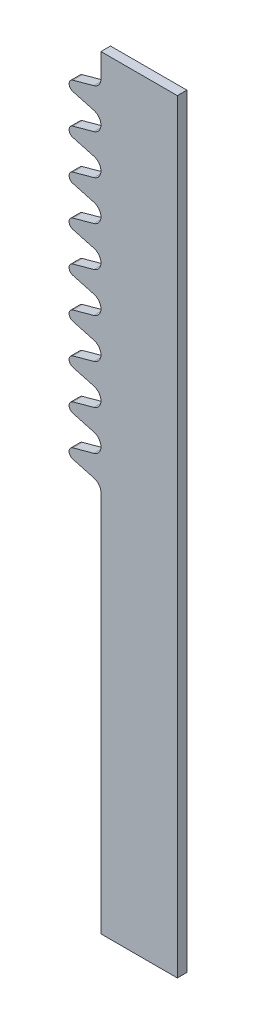
from build123d import *

# Parameters (mm, degrees)
SKETCH1_W           = 3.4
SKETCH1_H           = 24
BOSS_EXTRUDE1_DEPTH = 0.3
CUT_EXTRUDE1_DEPTH  = 13.123530839
CUT_EXTRUDE2_DEPTH  = 13.123530839
LPATTERN1_COUNT     = 9
LPATTERN1_PITCH     = 1.25
SKETCH3_W           = 1
SKETCH3_H           = 0.75
CUT_EXTRUDE3_DEPTH  = 13.123530839


with BuildPart() as part:
    # Sketch1 → Boss-Extrude1 (new body)
    with BuildSketch(Plane.XY):
        Rectangle(SKETCH1_W, SKETCH1_H)
    extrude(amount=-BOSS_EXTRUDE1_DEPTH)

    # Sketch2 → Cut-Extrude1 (cut, through all)
    with BuildSketch(Plane.XY):
        with BuildLine():
            Line((-1.7, -12), (-0.7, -12))
            Line((-0.7, -12), (-0.7, 0))
            ThreePointArc((-0.7, 0), (-0.761469345, 0.181942646), (-0.920687511, 0.289325991))
            Line((-0.920687511, 0.289325991), (-1.582299994, 0.470692805))
            ThreePointArc((-1.582299994, 0.470692805), (-1.667216349, 0.527963922), (-1.7, 0.625))
            Line((-1.7, 0.625), (-1.7, -12))
        make_face()
    extrude(amount=-CUT_EXTRUDE1_DEPTH, mode=Mode.SUBTRACT)

    # Sketch2<3> → Cut-Extrude2 (cut, through all)
    with BuildSketch(Plane.XY):
        with BuildLine():
            Line((-1.7, 1.875), (-1.7, 0.625))
            ThreePointArc((-1.7, 0.625), (-1.667216349, 0.722036078), (-1.582299994, 0.779307195))
            Line((-1.582299994, 0.779307195), (-0.920687511, 0.960674009))
            ThreePointArc((-0.920687511, 0.960674009), (-0.7, 1.25), (-0.920687511, 1.539325991))
            Line((-0.920687511, 1.539325991), (-1.582299994, 1.720692805))
            ThreePointArc((-1.582299994, 1.720692805), (-1.667216349, 1.777963922), (-1.7, 1.875))
        make_face()
    cut_extrude2 = extrude(amount=-CUT_EXTRUDE2_DEPTH, mode=Mode.SUBTRACT)

    # LPattern1: Cut-Extrude2 ×9
    with Locations(*[(0, i * LPATTERN1_PITCH, 0) for i in range(1, LPATTERN1_COUNT)]):
        add(cut_extrude2, mode=Mode.SUBTRACT)

    # Sketch3 → Cut-Extrude3 (cut, through all)
    with BuildSketch(Plane.XY):
        with Locations((-1.2, 11.625)):
            Rectangle(SKETCH3_W, SKETCH3_H)
    extrude(amount=-CUT_EXTRUDE3_DEPTH, mode=Mode.SUBTRACT)


solid = part.part
